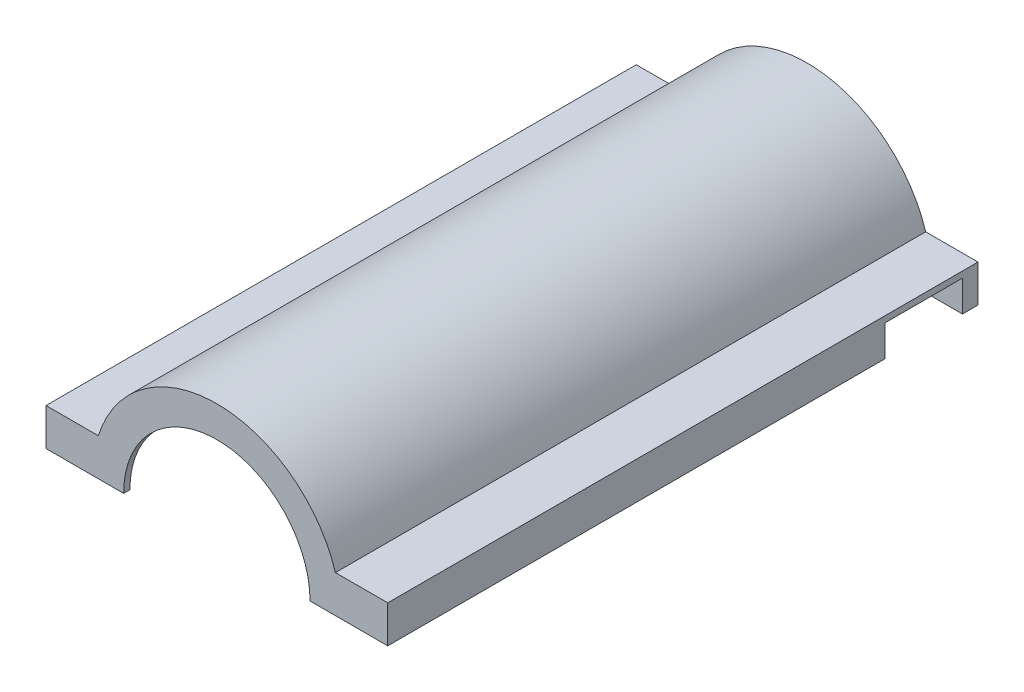
from build123d import *

# Parameters (mm, degrees)
BOSS_EXTRUDE1_DEPTH = 1900
SKETCH2_R           = 300
CUT_EXTRUDE1_DEPTH  = 2232.591360442
SKETCH4_W           = 250
SKETCH4_H           = 100
CUT_EXTRUDE3_DEPTH  = 550
SHELL1_START        = 320
SHELL1_DEPTH        = 1560
SHELL1_START_2      = 20
SHELL1_2_DEPTH      = 300
SHELL1_3_DEPTH      = 10


# Read off the part's stored shape, not the designer's step: Shell1
with BuildPart() as part:
    # Sketch1 → Boss-Extrude1 (new body)
    with BuildSketch(Plane.XY):
        with BuildLine():
            Line((931.575680567, 120), (1100, 120))
            Line((1100, 120), (1100, 0))
            Line((1100, 0), (0, 0))
            Line((0, 0), (0, 120))
            Line((0, 120), (168.424319433, 120))
            ThreePointArc((168.424319433, 120), (550, 400), (931.575680567, 120))
        make_face()
    extrude(amount=BOSS_EXTRUDE1_DEPTH)

    # Sketch2 → Cut-Extrude1 (cut, through all)
    with BuildSketch(Plane.XY.offset(1900)):
        with Locations((550, 0)):
            Circle(SKETCH2_R)
    extrude(amount=-CUT_EXTRUDE1_DEPTH, mode=Mode.SUBTRACT)

    # Sketch4 → Cut-Extrude3 (cut)
    with BuildSketch(Plane(origin=(1100, 0, 0), x_dir=(0, 0, -1), z_dir=(1, 0, 0))):
        with Locations((-175, 50)):
            Rectangle(SKETCH4_W, SKETCH4_H)
    extrude(amount=-CUT_EXTRUDE3_DEPTH, mode=Mode.SUBTRACT)

    # Shell1 outline → Shell1 (cut)
    with BuildSketch(Plane.XY.offset(SHELL1_START)):
        with BuildLine():
            ThreePointArc((916.606055596, 100), (550, 380), (183.393944404, 100))
            Line((183.393944404, 100), (20, 100))
            Line((20, 100), (20, 0))
            Line((20, 0), (250, 0))
            ThreePointArc((250, 0), (550, 300), (850, 0))
            Line((850, 0), (1080, 0))
            Line((1080, 0), (1080, 100))
            Line((1080, 100), (916.606055596, 100))
        make_face()
    extrude(amount=SHELL1_DEPTH, mode=Mode.SUBTRACT)

    # Shell1 2 outline → Shell1 2 (cut)
    with BuildSketch(Plane.XY.offset(SHELL1_START_2)):
        with BuildLine():
            Line((824.954541697, 120), (910.555127546, 120))
            ThreePointArc((910.555127546, 120), (539.552347988, 379.856349911), (183.393944404, 100))
            Line((183.393944404, 100), (20, 100))
            Line((20, 100), (20, 0))
            Line((20, 0), (250, 0))
            ThreePointArc((250, 0), (488.707106893, 293.671893879), (824.954541697, 120))
        make_face()
    extrude(amount=SHELL1_2_DEPTH, mode=Mode.SUBTRACT)

    # Shell1 3 outline → Shell1 3 (cut)
    with BuildSketch(Plane.XY.offset(SHELL1_START_2)):
        with BuildLine():
            ThreePointArc((916.606055596, 100), (913.718086665, 110.041598646), (910.555127546, 120))
            Line((910.555127546, 120), (824.954541697, 120))
            ThreePointArc((824.954541697, 120), (843.671893879, 61.292893107), (850, 0))
            Line((850, 0), (1080, 0))
            Line((1080, 0), (1080, 100))
            Line((1080, 100), (916.606055596, 100))
        make_face()
    extrude(amount=SHELL1_3_DEPTH, mode=Mode.SUBTRACT)


solid = part.part
